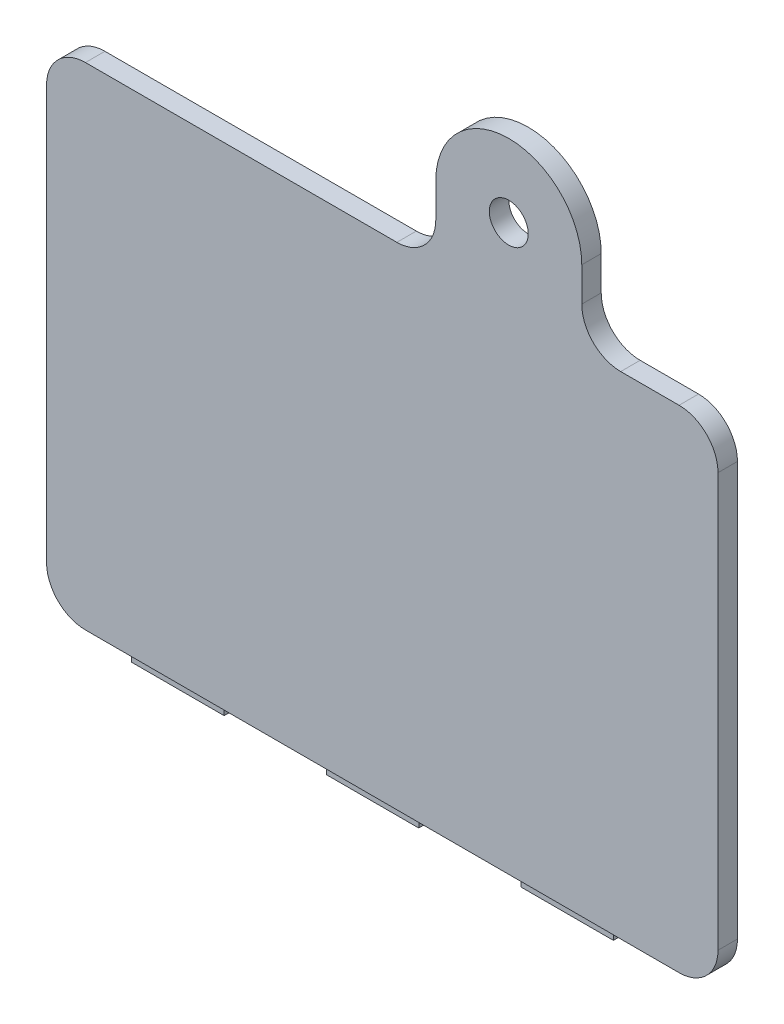
from build123d import *

# Parameters (mm, degrees)
ESQUISSE1_R             = 2
BOSS_EXTRU_1_DEPTH      = 2
ESQUISSE2_W             = 9.5
ESQUISSE2_H             = 2
BOSS_EXTRU_2_DEPTH      = 2.5
CHANFREIN1_SIZE         = 2
ENL_V_MAT_EXTRU_2_REACH = 57.157
ESQUISSE4_W             = 6
ESQUISSE4_H             = 50.5
CONG_1_R                = 4


with BuildPart() as part:
    # Esquisse1 → Boss.-Extru.1 (new body)
    with BuildSketch(Plane.XY):
        with BuildLine():
            ThreePointArc((8.5, 32.75), (16, 40.25), (23.5, 32.75))
            Line((23.5, 32.75), (23.5, 25.25))
            Line((23.5, 25.25), (37.5, 25.25))
            Line((37.5, 25.25), (37.5, -25.25))
            Line((37.5, -25.25), (-37.5, -25.25))
            Line((-37.5, -25.25), (-37.5, 25.25))
            Line((-37.5, 25.25), (8.5, 25.25))
            Line((8.5, 25.25), (8.5, 32.75))
        make_face()
        with Locations((16, 32.75)):
            Circle(ESQUISSE1_R, mode=Mode.SUBTRACT)
    extrude(amount=BOSS_EXTRU_1_DEPTH)

    # Esquisse2 → Boss.-Extru.2 (add, symmetric)
    with BuildSketch(Plane.XZ.offset(25.25)):
        with Locations((0, -1)):
            Rectangle(ESQUISSE2_W, ESQUISSE2_H)
        with Locations((-20, -1)):
            Rectangle(ESQUISSE2_W, ESQUISSE2_H)
        with Locations((20, -1)):
            Rectangle(ESQUISSE2_W, ESQUISSE2_H)
    extrude(amount=BOSS_EXTRU_2_DEPTH, both=True)

    # Chanfrein1
    chanfrein1_edges = [part.edges().sort_by_distance(p)[0] for p in [
        (-20, -22.75, 0),
        (0, -22.75, 0),
        (20, -22.75, 0),
    ]]
    chamfer(chanfrein1_edges, length=CHANFREIN1_SIZE - 0.0001)  # a hair under: the kernel refuses the full size

    # Esquisse4 → Enlèv. mat.-Extru.2 (cut, up to next)
    with BuildSketch(Plane.XY.offset(2), mode=Mode.PRIVATE) as enl_v_mat_extru_2_sk1:
        with Locations((-34.5, 0)):
            Rectangle(ESQUISSE4_W, ESQUISSE4_H)
    enl_v_mat_extru_2_tool1 = extrude(enl_v_mat_extru_2_sk1.sketch, amount=-ENL_V_MAT_EXTRU_2_REACH, mode=Mode.PRIVATE) & part.part
    add(enl_v_mat_extru_2_tool1.solids().sort_by_distance((-34.5, 0, 2))[0], mode=Mode.SUBTRACT)

    # Congé1
    cong_1_edges = [part.edges().sort_by_distance(p)[0] for p in [
        (-31.5, 25.25, 1),
        (-31.5, -25.25, 1),
        (23.5, 25.25, 1),
        (37.5, 25.25, 1),
        (37.5, -25.25, 1),
        (8.5, 25.25, 1),
    ]]
    fillet(cong_1_edges, radius=CONG_1_R)


solid = part.part
